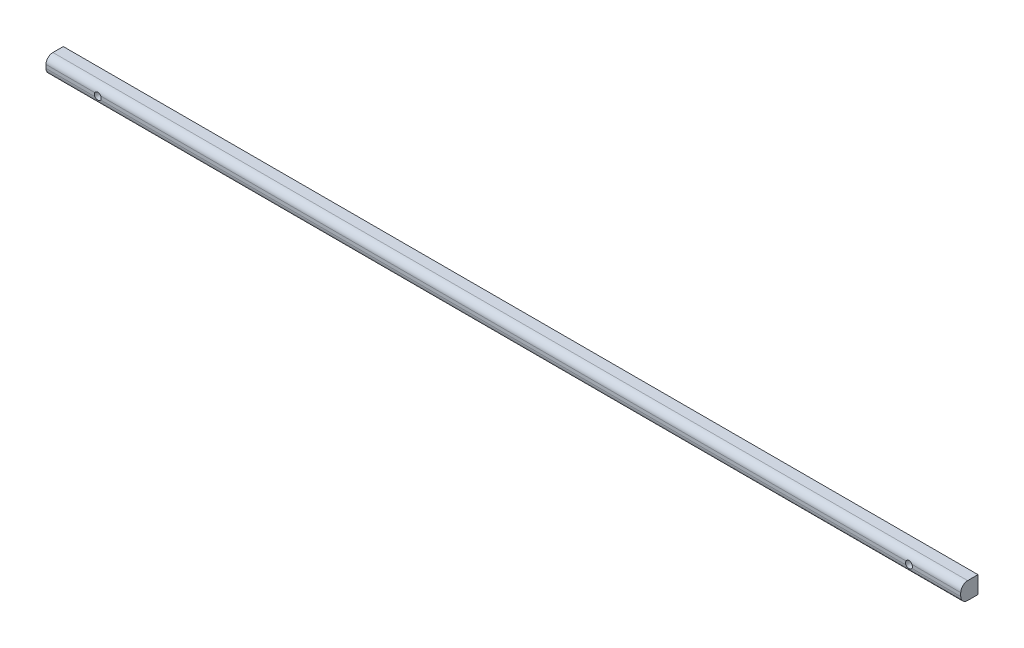
from build123d import *

# Parameters (mm, degrees)
SKETCH1_W           = 265
SKETCH1_H           = 5
BOSS_EXTRUDE1_DEPTH = 5
SKETCH2_R           = 1
CUT_EXTRUDE1_DEPTH  = 266.094322836
FILLET1_R           = 2


with BuildPart() as part:
    # Sketch1 → Boss-Extrude1 (new body)
    with BuildSketch(Plane.XY):
        with Locations((-132.5, 2.5)):
            Rectangle(SKETCH1_W, SKETCH1_H)
    extrude(amount=BOSS_EXTRUDE1_DEPTH)

    # Sketch2 → Cut-Extrude1 (cut, through all)
    with BuildSketch(Plane.XY.offset(5)):
        with Locations((-250, 2.5)):
            Circle(SKETCH2_R)
        with Locations(Location((-15, 2.5, 0), (0, 0, 180))):
            Circle(SKETCH2_R)
    extrude(amount=-CUT_EXTRUDE1_DEPTH, mode=Mode.SUBTRACT)

    # Fillet1
    # the kernel refuses this fillet: 2 mm, written as the material it takes off along each edge
    with BuildSketch(Plane(origin=(5, 0, 5), x_dir=(0, 0, -1), z_dir=(-1, 0, 0))) as fillet1_piece_1:
        with BuildLine():
            CenterArc((FILLET1_R, -FILLET1_R), FILLET1_R, 90, 90)
            Line((0, -FILLET1_R), (0, 0))
            Line((0, 0), (FILLET1_R, 0))
        make_face()
    extrude(amount=275, mode=Mode.SUBTRACT)
    with BuildSketch(Plane(origin=(-270, 5, 5), x_dir=(0, -1, 0), z_dir=(1, 0, 0))) as fillet1_piece_2:
        with BuildLine():
            CenterArc((FILLET1_R, FILLET1_R), FILLET1_R, 180, 90)
            Line((0, FILLET1_R), (0, 0))
            Line((0, 0), (FILLET1_R, 0))
        make_face()
    extrude(amount=275, mode=Mode.SUBTRACT)


solid = part.part
